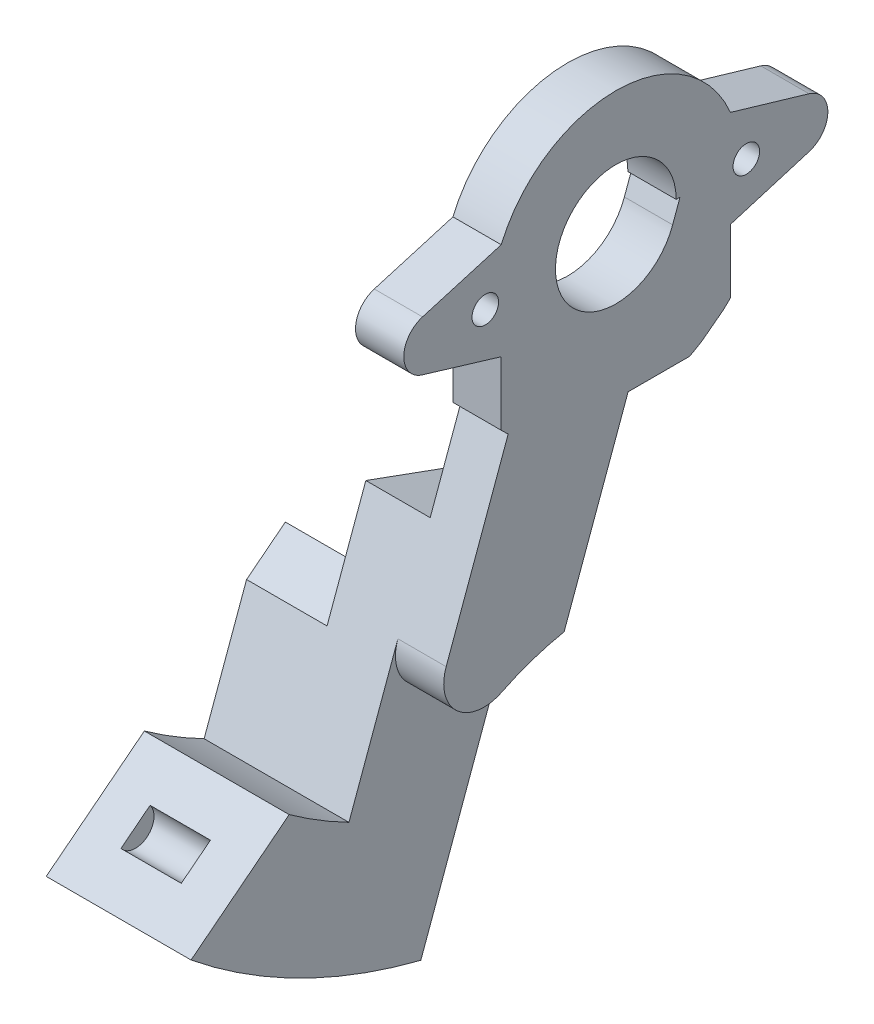
from build123d import *

# Parameters (mm, degrees)
BOSS_EXTRUDE1_DEPTH     = 5
BOSS_EXTRUDE2_DEPTH     = 13
CUT_EXTRUDE1_START      = -13
SKETCH3_R               = 2.3
CUT_EXTRUDE1_DEPTH      = 7.5
SKETCH4_R               = 1.65
BOSS_EXTRUDE3_DEPTH     = 6
CUT_EXTRUDE2_DEPTH      = 86.071137152
CUT_EXTRUDE2_DEPTH_BACK = 10
SKETCH9_R               = 1.65
CUT_EXTRUDE3_DEPTH      = 6


with BuildPart() as part:
    # Sketch1 → Boss-Extrude1 (new body)
    with BuildSketch(Plane(origin=(0, 0, 0), x_dir=(0, 0, -1), z_dir=(1, 0, 0))):
        with BuildLine():
            Line((-34.593659354, 3.256520294), (-46.7897518, -6.296129983))
            ThreePointArc((-46.7897518, -6.296129983), (-33.290290023, -15.004245976), (-18.234604608, -20.60719958))
            Line((-18.234604608, -20.60719958), (-2.973495544, 21.32235297))
            Line((-2.973495544, 21.32235297), (-17.068884855, 26.45265512))
            Line((-17.068884855, 26.45265512), (-27.166620772, -1.290646299))
            ThreePointArc((-27.166620772, -1.290646299), (-30.963724442, 0.846415848), (-34.593659354, 3.256520294))
        make_face()
    extrude(amount=BOSS_EXTRUDE1_DEPTH)

    # Sketch2 → Boss-Extrude2 (add)
    with BuildSketch(Plane(origin=(5, 0, 0), x_dir=(0, 0, -1), z_dir=(1, 0, 0))):
        with BuildLine():
            Line((-34.593659354, 3.256520294), (-46.7897518, -6.296129983))
            ThreePointArc((-46.7897518, -6.296129983), (-42.613802597, -9.444548196), (-38.226724688, -12.291412509))
            Line((-38.226724688, -12.291412509), (-25.335917908, -2.194623762))
            ThreePointArc((-25.335917908, -2.194623762), (-26.255160174, -1.750514609), (-27.166620772, -1.290646299))
            ThreePointArc((-27.166620772, -1.290646299), (-30.963724442, 0.846415848), (-34.593659354, 3.256520294))
        make_face()
        with BuildLine():
            Line((-25.335917908, -2.194623762), (-38.226724688, -12.291412509))
            ThreePointArc((-38.226724688, -12.291412509), (-28.535215176, -17.181480963), (-18.234604608, -20.60719958))
            Line((-18.234604608, -20.60719958), (-12.16072752, -3.919359432))
            Line((-12.16072752, -3.919359432), (-2.973495544, 21.32235297))
            Line((-2.973495544, 21.32235297), (-17.068884855, 26.45265512))
            Line((-17.068884855, 26.45265512), (-26.256116832, 1.210942718))
            Line((-26.256116832, 1.210942718), (-27.166620772, -1.290646299))
            ThreePointArc((-27.166620772, -1.290646299), (-26.255160174, -1.750514609), (-25.335917908, -2.194623762))
        make_face()
    extrude(amount=BOSS_EXTRUDE2_DEPTH)

    # Sketch3 → Cut-Extrude1 (cut)
    with BuildSketch(Plane(origin=(18, 0, 0), x_dir=(0, 0, -1), z_dir=(1, 0, 0)).offset(CUT_EXTRUDE1_START)):
        with Locations((-40.691705577, -1.519804845)):
            Circle(SKETCH3_R)
    extrude(amount=CUT_EXTRUDE1_DEPTH, mode=Mode.SUBTRACT)

    # Sketch4 → Boss-Extrude3 (add)
    with BuildSketch(Plane(origin=(18, 0, 0), x_dir=(0, 0, -1), z_dir=(1, 0, 0))):
        with BuildLine():
            Line((-13.371212035, 36.611927698), (-21.083585591, 15.422355502))
            ThreePointArc((-21.083585591, 15.422355502), (-19.723042607, 9.989582455), (-14.174598147, 9.227437939))
            ThreePointArc((-14.174598147, 9.227437939), (-10.385594526, 10.792784565), (-6.423166383, 11.844460235))
            Line((-6.423166383, 11.844460235), (1.530859032, 33.697965455))
            Line((1.530859032, 33.697965455), (9.165031814, 33.697965455))
            ThreePointArc((9.165031814, 33.697965455), (9.933965272, 34.117264651), (10.683756157, 34.569905907))
            Line((10.683756157, 34.569905907), (13.30556247, 36.552911383))
            ThreePointArc((13.30556247, 36.552911383), (13.786023096, 36.997313573), (14.25164947, 37.457235089))
            Line((14.25164947, 37.457235089), (14.25164947, 45.3641606))
            Line((14.25164947, 45.3641606), (24.03628358, 48.30778647))
            ThreePointArc((24.03628358, 48.30778647), (26.349985315, 51.429769983), (24.017555191, 54.53778647))
            Line((24.017555191, 54.53778647), (14.241296463, 57.414910041))
            ThreePointArc((14.241296463, 57.414910041), (0, 66.87164947), (-14.241296463, 57.414910041))
            Line((-14.241296463, 57.414910041), (-24.017555191, 54.53778647))
            ThreePointArc((-24.017555191, 54.53778647), (-26.349985315, 51.429769983), (-24.03628358, 48.30778647))
            Line((-24.03628358, 48.30778647), (-14.25164947, 45.3641606))
            Line((-14.25164947, 45.3641606), (-14.25164947, 37.457235089))
            ThreePointArc((-14.25164947, 37.457235089), (-13.817896207, 37.027847242), (-13.371212035, 36.611927698))
        make_face()
        with BuildLine():
            Line((7.5, 51.42), (7.981152097, 51.42))
            Line((7.981152097, 51.42), (7.064819397, 48.902396598))
            ThreePointArc((7.064819397, 48.902396598), (-7.390404098, 52.697469085), (7.5, 51.42))
        make_face(mode=Mode.SUBTRACT)
        with Locations((16.22, 51.42)):
            Circle(SKETCH4_R, mode=Mode.SUBTRACT)
        with Locations((-16.22, 51.42)):
            Circle(SKETCH4_R, mode=Mode.SUBTRACT)
    extrude(amount=BOSS_EXTRUDE3_DEPTH)

    # Sketch8 → Cut-Extrude2 (cut, two sides: drawn at the far end of the back side and taken through both)
    with BuildSketch(Plane.ZY.offset(-CUT_EXTRUDE2_DEPTH_BACK)):
        Polygon((17.068884855, -17.404410883), (17.068884855, 16.982887384), (8.814387371, 23.448263736), (2.973495544, 21.32235297), align=None)
        Polygon((8.814387371, 23.448263736), (17.068884855, 16.982887384), (17.068884855, 26.45265512), align=None)
        Polygon((17.068884855, 16.982887384), (21.890012849, 13.206714822), (17.068884855, 26.45265512), align=None)
    extrude(amount=CUT_EXTRUDE2_DEPTH + CUT_EXTRUDE2_DEPTH_BACK, mode=Mode.SUBTRACT)

    # Sketch9 → Cut-Extrude3 (cut)
    with BuildSketch(Plane.ZY):
        with Locations((24.568884855, -6.047927384)):
            Circle(SKETCH9_R)
        with Locations((37.335347169, -3.97184687)):
            Circle(SKETCH9_R)
        with Locations((21.576904852, -15.17107203)):
            Circle(SKETCH9_R)
    extrude(amount=-CUT_EXTRUDE3_DEPTH, mode=Mode.SUBTRACT)


solid = part.part
